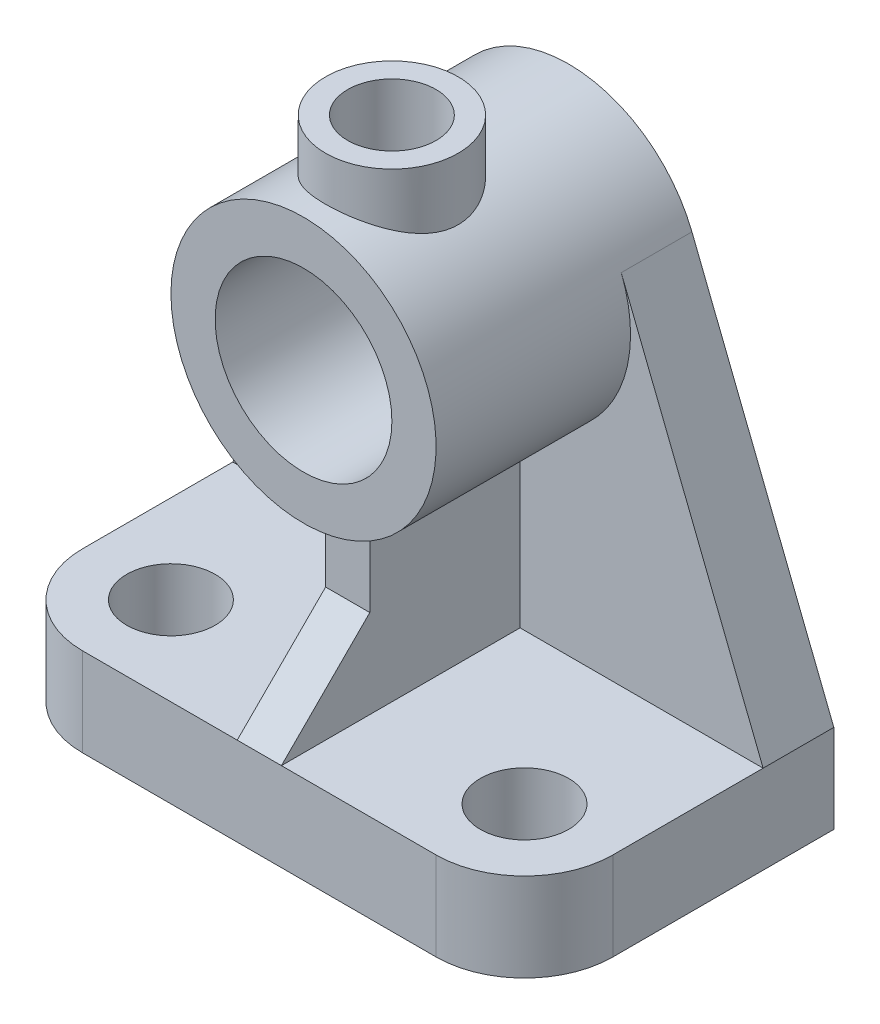
from build123d import *

# Parameters (mm, degrees)
SKETCH_4_W               = 60
SKETCH_4_H               = 35
SKETCH_4_R               = 5
EXTRUDE_1_DEPTH          = 10
FILLET_1_R               = 10
FILLET_2_R               = 10
EXTRUDE_2_DEPTH          = 8
SKETCH_6_R               = 15
EXTRUDE_3_DEPTH          = 30
SKETCH_8_R               = 10
CUT_EXTRUDE_1_DEPTH      = 74.484692283
EXTRUDE_4_REACH          = 76.33
EXTRUDE_4_END_RADIUS     = 15
SKETCH_9_R               = 7.5
CUT_EXTRUDE_2_REACH      = 76.33
CUT_EXTRUDE_2_END_RADIUS = 10
SKETCH_10_R              = 5
RIB_START                = -2.5
RIB_1_DEPTH              = 5


# Read off the part's stored shape, not the designer's step: 筋1
with BuildPart() as part:
    # 草图4 → 凸台-拉伸1 (new body)
    with BuildSketch(Plane(origin=(0, 0, 0), x_dir=(1, 0, 0), z_dir=(0, 1, 0))):
        with Locations((0, 2.5)):
            Rectangle(SKETCH_4_W, SKETCH_4_H)
        with Locations(Location((-20, -5, 0), (0, 0, 270))):
            Circle(SKETCH_4_R, mode=Mode.SUBTRACT)
        with Locations(Location((20, -5, 0), (0, 0, 90))):
            Circle(SKETCH_4_R, mode=Mode.SUBTRACT)
    extrude(amount=EXTRUDE_1_DEPTH)

    # 圆角1
    fillet_1_edges = [part.edges().sort_by_distance(p)[0] for p in [
        (-30, 5, 15),
    ]]
    fillet(fillet_1_edges, radius=FILLET_1_R)

    # 圆角2
    fillet_2_edges = [part.edges().sort_by_distance(p)[0] for p in [
        (30, 5, 15),
    ]]
    fillet(fillet_2_edges, radius=FILLET_2_R)

    # 草图5 → 凸台-拉伸2 (add)
    with BuildSketch(Plane(origin=(0, 0, -20), x_dir=(-1, 0, 0), z_dir=(0, 0, -1))):
        with BuildLine():
            Line((-30, 10), (-13.945515037, 50.524727174))
            ThreePointArc((-13.945515037, 50.524727174), (0, 60), (13.945515037, 50.524727174))
            Line((13.945515037, 50.524727174), (30, 10))
            Line((30, 10), (-30, 10))
        make_face()
    extrude(amount=-EXTRUDE_2_DEPTH)

    # 草图6 → 凸台-拉伸3 (add)
    with BuildSketch(Plane(origin=(0, 0, -20), x_dir=(-1, 0, 0), z_dir=(0, 0, -1))):
        with Locations((0, 45)):
            Circle(SKETCH_6_R)
    extrude(amount=-EXTRUDE_3_DEPTH)

    # 草图8 → 切除-拉伸1 (cut, through all)
    with BuildSketch(Plane.XY.offset(10)):
        with Locations((0, 45)):
            Circle(SKETCH_8_R)
    extrude(amount=-CUT_EXTRUDE_1_DEPTH, mode=Mode.SUBTRACT)

    # 凸台-拉伸4: up to this cylinder (the profile starts outside it)
    extrude_4_end = Plane(origin=(0, 45, 0), z_dir=(0, 0, -1)) * Cylinder(EXTRUDE_4_END_RADIUS, 183.66, mode=Mode.PRIVATE)
    # 草图9 → 凸台-拉伸4 (add, up to the surface)
    with BuildSketch(Plane(origin=(0, 65, 0), x_dir=(1, 0, 0), z_dir=(0, 1, 0)), mode=Mode.PRIVATE) as extrude_4_sk1:
        with Locations(Location((0, 0, 0), (0, 0, 270))):
            Circle(SKETCH_9_R)
    extrude_4_tool1 = extrude(extrude_4_sk1.sketch, amount=-EXTRUDE_4_REACH, mode=Mode.PRIVATE) - extrude_4_end
    add(extrude_4_tool1.solids().sort_by_distance((0, 65, 0))[0])

    # 切除-拉伸2: up to this cylinder (the profile starts outside it)
    cut_extrude_2_end = Plane(origin=(0, 45, 0), z_dir=(0, 0, 1)) * Cylinder(CUT_EXTRUDE_2_END_RADIUS, 173.66, mode=Mode.PRIVATE)
    # 草图10 → 切除-拉伸2 (cut, up to the surface)
    with BuildSketch(Plane(origin=(0, 65, 0), x_dir=(1, 0, 0), z_dir=(0, 1, 0)), mode=Mode.PRIVATE) as cut_extrude_2_sk1:
        with Locations(Location((0, 0, 0), (0, 0, 270))):
            Circle(SKETCH_10_R)
    cut_extrude_2_tool1 = extrude(cut_extrude_2_sk1.sketch, amount=-CUT_EXTRUDE_2_REACH, mode=Mode.PRIVATE) - cut_extrude_2_end
    add(cut_extrude_2_tool1.solids().sort_by_distance((0, 65, 0))[0], mode=Mode.SUBTRACT)

    # 筋1 outline → 筋1 (add)
    with BuildSketch(Plane(origin=(0, 0, 0), x_dir=(0, 0, -1), z_dir=(1, 0, 0)).offset(RIB_START)):
        Polygon((-5, 32), (-5, 20), (-15, 10), (12, 10), (12, 32), align=None)
    extrude(amount=RIB_1_DEPTH)


solid = part.part
